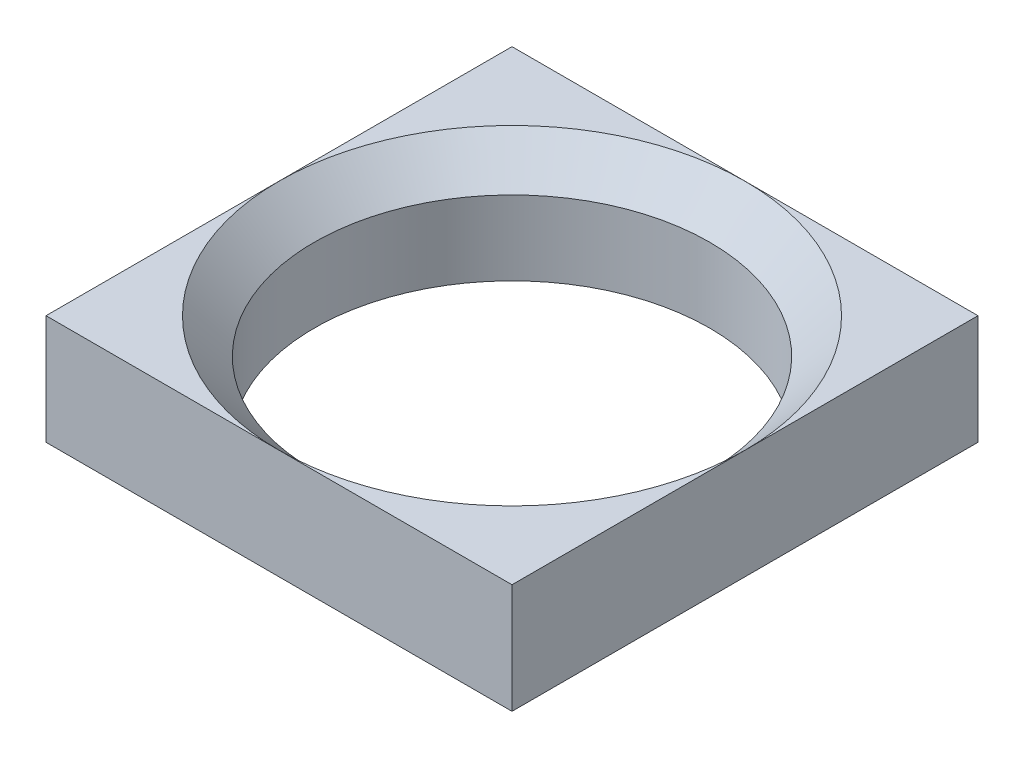
from build123d import *

# Parameters (mm, degrees)
SKETCH_1_W      = 11.9
SKETCH_1_H      = 11.9
SKETCH_1_R      = 5.05
EXTRUDE_1_DEPTH = 2.8
CHAMFER_1_SIZE  = 0.9


with BuildPart() as part:
    # 草图1 → 凸台-拉伸1 (new body)
    with BuildSketch(Plane(origin=(0, 0, 0), x_dir=(1, 0, 0), z_dir=(0, 1, 0))):
        Rectangle(SKETCH_1_W, SKETCH_1_H)
        with Locations(Location((0, 0, 0), (0, 0, 270))):
            Circle(SKETCH_1_R, mode=Mode.SUBTRACT)
    extrude(amount=EXTRUDE_1_DEPTH)

    # 倒角1
    chamfer_1_edges = [part.edges().sort_by_distance(p)[0] for p in [
        (0, 2.8, -5.05),
    ]]
    chamfer(chamfer_1_edges, length=CHAMFER_1_SIZE - 0.0001)  # a hair under: the kernel refuses the full size


solid = part.part
